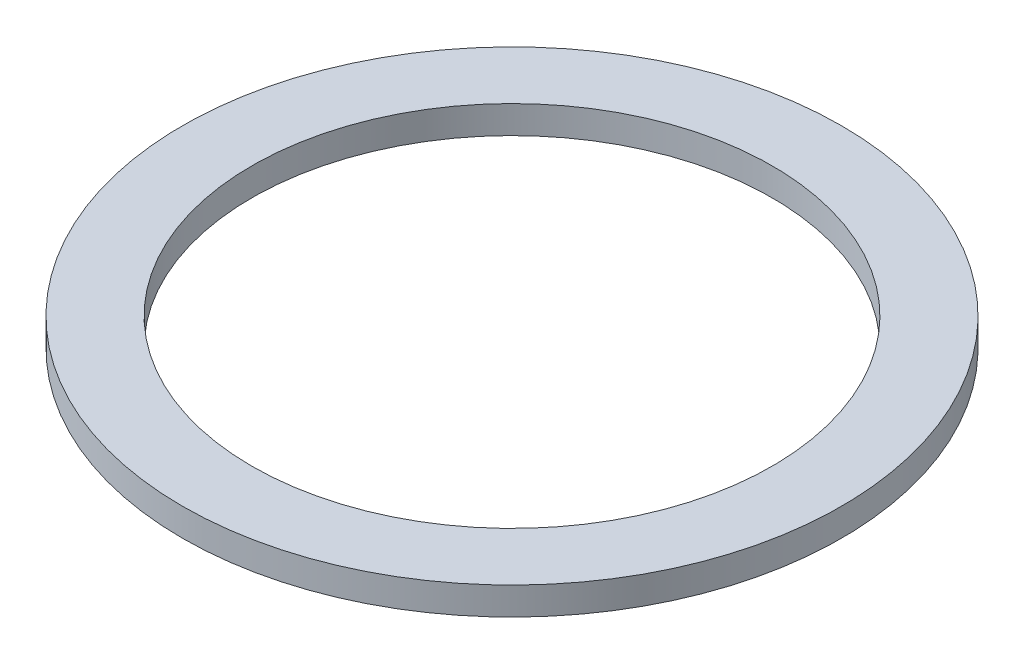
from build123d import *

# Parameters (mm, degrees)
SKETCH1_R           = 47.5
BOSS_EXTRUDE1_DEPTH = 4
SKETCH2_R           = 37.5
CUT_EXTRUDE1_DEPTH  = 68.294130502


with BuildPart() as part:
    # Sketch1 → Boss-Extrude1 (new body)
    with BuildSketch(Plane(origin=(0, 0, 0), x_dir=(1, 0, 0), z_dir=(0, 1, 0))):
        Circle(SKETCH1_R)
    extrude(amount=BOSS_EXTRUDE1_DEPTH)

    # Sketch2 → Cut-Extrude1 (cut, through all)
    with BuildSketch(Plane(origin=(0, 0, 0), x_dir=(1, 0, 0), z_dir=(0, 1, 0))):
        Circle(SKETCH2_R)
    extrude(amount=CUT_EXTRUDE1_DEPTH, mode=Mode.SUBTRACT)


solid = part.part
